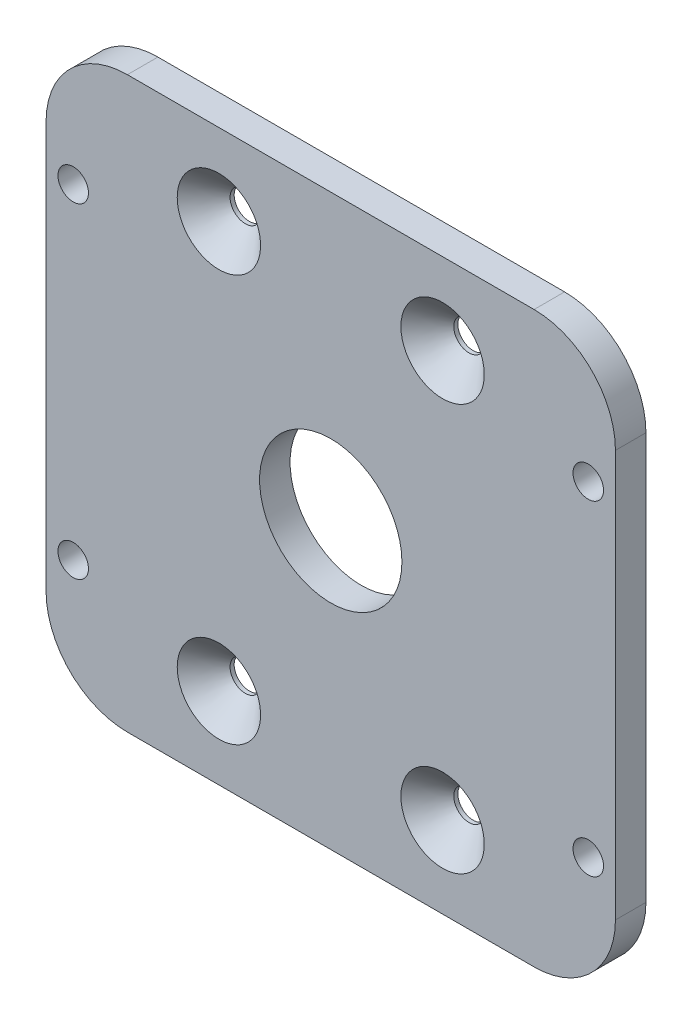
from build123d import *

# Parameters (mm, degrees)
EXTRUDE_1_DEPTH     = 3
SKETCH_2_R          = 7
CUT_EXTRUDE_1_DEPTH = 80.252760204
SKETCH_3_R          = 1.5
CUT_EXTRUDE_2_DEPTH = 80.252760204
SKETCH_4_R          = 1.5
CUT_EXTRUDE_3_DEPTH = 80.252760204
CHAMFER_1_SIZE      = 2.6


with BuildPart() as part:
    # Эскиз1 → Бобышка-Вытянуть1 (new body)
    with BuildSketch(Plane.XY):
        with BuildLine():
            Line((8, 0), (48, 0))
            ThreePointArc((48, 0), (53.656854249, 2.343145751), (56, 8))
            Line((56, 8), (56, 48))
            ThreePointArc((56, 48), (53.656854249, 53.656854249), (48, 56))
            Line((48, 56), (8, 56))
            ThreePointArc((8, 56), (2.343145751, 53.656854249), (0, 48))
            Line((0, 48), (0, 8))
            ThreePointArc((0, 8), (2.343145751, 2.343145751), (8, 0))
        make_face()
    extrude(amount=EXTRUDE_1_DEPTH)

    # Эскиз2 → Вырез-Вытянуть1 (cut, through all)
    with BuildSketch(Plane.XY.offset(3)):
        with Locations((28, 28)):
            Circle(SKETCH_2_R)
    extrude(amount=-CUT_EXTRUDE_1_DEPTH, mode=Mode.SUBTRACT)

    # Эскиз3 → Вырез-Вытянуть2 (cut, through all)
    with BuildSketch(Plane.XY.offset(3)):
        with Locations((2.67, 12)):
            Circle(SKETCH_3_R)
        with Locations((53.33, 12)):
            Circle(SKETCH_3_R)
        with Locations((53.33, 44)):
            Circle(SKETCH_3_R)
        with Locations((2.67, 44)):
            Circle(SKETCH_3_R)
    extrude(amount=-CUT_EXTRUDE_2_DEPTH, mode=Mode.SUBTRACT)

    # Эскиз4 → Вырез-Вытянуть3 (cut, through all)
    with BuildSketch(Plane.XY.offset(3)):
        with Locations((17, 8)):
            Circle(SKETCH_4_R)
        with Locations((39, 8)):
            Circle(SKETCH_4_R)
        with Locations((39, 48)):
            Circle(SKETCH_4_R)
        with Locations((17, 48)):
            Circle(SKETCH_4_R)
    extrude(amount=-CUT_EXTRUDE_3_DEPTH, mode=Mode.SUBTRACT)

    # Фаска1
    chamfer_1_edges = [part.edges().sort_by_distance(p)[0] for p in [
        (37.5, 8, 3),
        (15.5, 8, 3),
        (37.5, 48, 3),
        (15.5, 48, 3),
    ]]
    chamfer(chamfer_1_edges, length=CHAMFER_1_SIZE)


solid = part.part
